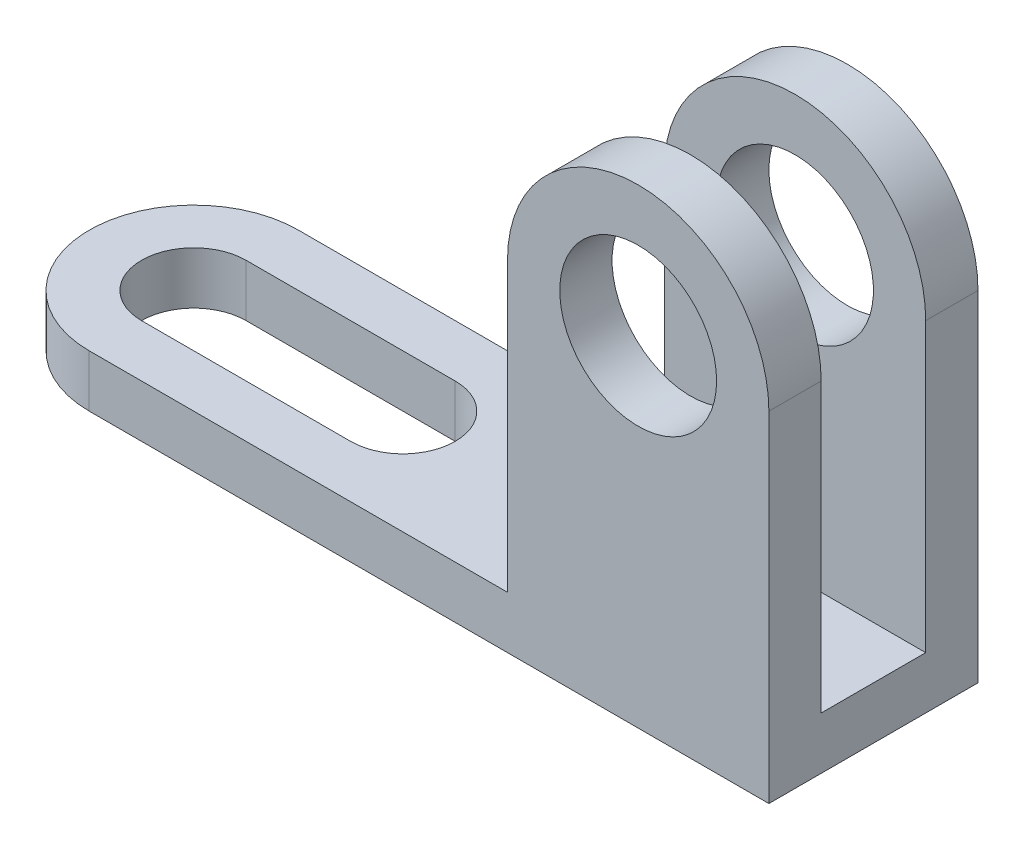
from build123d import *

# Parameters (mm, degrees)
BOSS_EXTRUDE1_DEPTH = 10
SKETCH2_W           = 50
SKETCH2_H           = 10
BOSS_EXTRUDE2_DEPTH = 80
SKETCH3_R           = 15
CUT_EXTRUDE2_DEPTH  = 80
SKETCH4_W           = 50
SKETCH4_H           = 10
BOSS_EXTRUDE3_DEPTH = 80
CUT_EXTRUDE3_START  = -80
SKETCH5_R           = 15
CUT_EXTRUDE3_DEPTH  = 80


with BuildPart() as part:
    # Sketch1 → Boss-Extrude1 (new body)
    with BuildSketch(Plane(origin=(0, 0, 0), x_dir=(1, 0, 0), z_dir=(0, 1, 0))):
        with BuildLine():
            Line((20, 0), (150, 0))
            Line((150, 0), (150, 40))
            Line((150, 40), (20, 40))
            ThreePointArc((20, 40), (0, 20), (20, 0))
        make_face()
        with BuildLine():
            Line((20, 30), (60, 30))
            ThreePointArc((60, 30), (70, 20), (60, 10))
            Line((60, 10), (20, 10))
            ThreePointArc((20, 10), (10, 20), (20, 30))
        make_face(mode=Mode.SUBTRACT)
    extrude(amount=BOSS_EXTRUDE1_DEPTH)

    # Sketch2 → Boss-Extrude2 (add)
    with BuildSketch(Plane(origin=(0, 10, 0), x_dir=(1, 0, 0), z_dir=(0, 1, 0))):
        with Locations((125, 5)):
            Rectangle(SKETCH2_W, SKETCH2_H)
    extrude(amount=BOSS_EXTRUDE2_DEPTH)

    # Sketch3 → Cut-Extrude2 (cut)
    with BuildSketch(Plane.XY):
        with Locations((125, 65)):
            Circle(SKETCH3_R)
        with BuildLine():
            ThreePointArc((100, 65), (107.32233047, 82.67766953), (125, 90))
            Line((125, 90), (100, 90))
            Line((100, 90), (100, 65))
        make_face()
        with BuildLine():
            ThreePointArc((125, 90), (142.67766953, 82.67766953), (150, 65))
            Line((150, 65), (150, 90))
            Line((150, 90), (125, 90))
        make_face()
    extrude(amount=-CUT_EXTRUDE2_DEPTH, mode=Mode.SUBTRACT)

    # Sketch4 → Boss-Extrude3 (add)
    with BuildSketch(Plane(origin=(0, 10, 0), x_dir=(1, 0, 0), z_dir=(0, 1, 0))):
        with Locations((125, 35)):
            Rectangle(SKETCH4_W, SKETCH4_H)
    extrude(amount=BOSS_EXTRUDE3_DEPTH)

    # Sketch5 → Cut-Extrude3 (cut)
    with BuildSketch(Plane(origin=(0, 0, -40), x_dir=(-1, 0, 0), z_dir=(0, 0, -1)).offset(CUT_EXTRUDE3_START)):
        with BuildLine():
            ThreePointArc((-150, 65), (-142.67766953, 82.67766953), (-125, 90))
            Line((-125, 90), (-150, 90))
            Line((-150, 90), (-150, 65))
        make_face()
        with BuildLine():
            ThreePointArc((-125, 90), (-107.32233047, 82.67766953), (-100, 65))
            Line((-100, 65), (-100, 90))
            Line((-100, 90), (-125, 90))
        make_face()
        with Locations((-125, 65)):
            Circle(SKETCH5_R)
    extrude(amount=CUT_EXTRUDE3_DEPTH, mode=Mode.SUBTRACT)


solid = part.part
